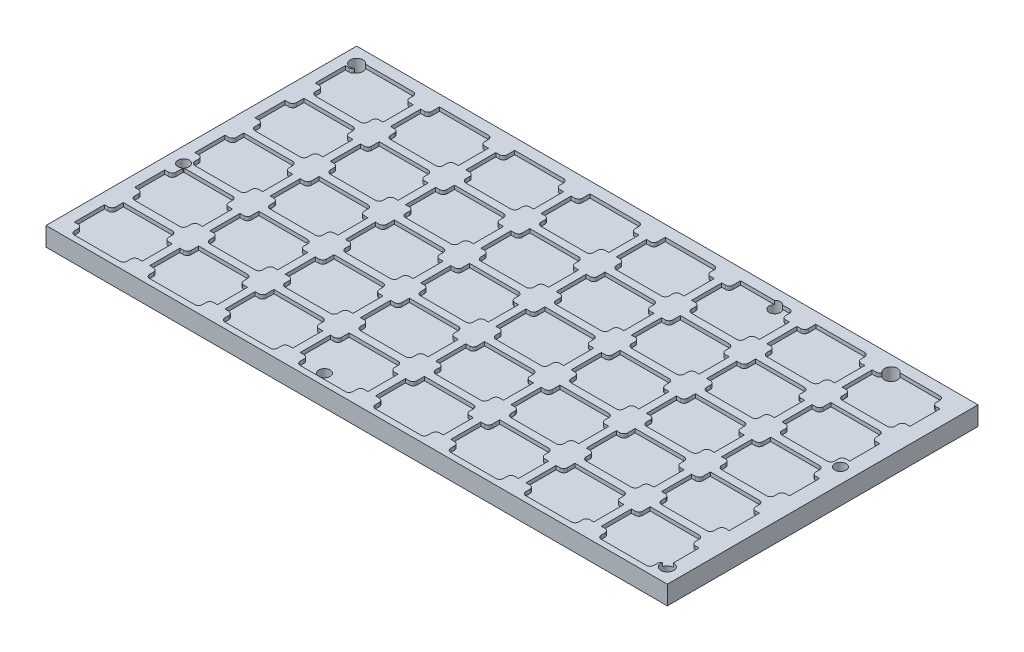
from build123d import *

# Parameters (mm, degrees)
SKETCH1_W                                       = 165.1
SKETCH1_H                                       = 82.55
BOSS_EXTRUDE1_DEPTH                             = 5
SKETCH2_W                                       = 14
SKETCH2_H                                       = 14
SKETCH2_W_2                                     = 2
SKETCH2_H_2                                     = 8
CUT_EXTRUDE1_DEPTH                              = 1
FILLET1_R                                       = 1
LPATTERN1_START                                 = 4
LPATTERN1_DEPTH                                 = 1
CSK_FOR_M3_FLAT_HEAD_MACHINE_SCREW1_D           = 3.4
CSK_FOR_M3_FLAT_HEAD_MACHINE_SCREW1_DEPTH       = 17.07
CSK_FOR_M3_FLAT_HEAD_MACHINE_SCREW1_CSINK_D     = 6.3
CSK_FOR_M3_FLAT_HEAD_MACHINE_SCREW1_CSINK_ANGLE = 90
CSK_FOR_M3_FLAT_HEAD_MACHINE_SCREW1_TIP         = 1.021463052
CSK_FOR_M3_FLAT_HEAD_MACHINE_SCREW2_D           = 3
CSK_FOR_M3_FLAT_HEAD_MACHINE_SCREW2_CSINK_D     = 6
CSK_FOR_M3_FLAT_HEAD_MACHINE_SCREW2_CSINK_ANGLE = 150


# Read off the part's stored shape, not the designer's step: LPattern1
with BuildPart() as part:
    # Sketch1 → Boss-Extrude1 (new body)
    with BuildSketch(Plane(origin=(0, 0, 0), x_dir=(1, 0, 0), z_dir=(0, 1, 0))):
        with Locations((81.157910906, -40.789208909)):
            Rectangle(SKETCH1_W, SKETCH1_H)
    extrude(amount=BOSS_EXTRUDE1_DEPTH)

    # Sketch2 → Cut-Extrude1 (cut)
    with BuildSketch(Plane(origin=(0, 5, 0), x_dir=(1, 0, 0), z_dir=(0, 1, 0))):
        with Locations((10.607910906, -9.514208909)):
            Rectangle(SKETCH2_W, SKETCH2_H)
        with Locations((18.607910906, -9.514208909)):
            Rectangle(SKETCH2_W_2, SKETCH2_H_2)
        with Locations((2.607910906, -9.514208909)):
            Rectangle(SKETCH2_W_2, SKETCH2_H_2)
    extrude(amount=-CUT_EXTRUDE1_DEPTH, mode=Mode.SUBTRACT)

    # Fillet1
    fillet1_edges = [part.edges().sort_by_distance(p)[0] for p in [
        (3.607910906, 4.5, 5.514208909),
        (3.607910906, 4.5, 13.514208909),
        (3.607910906, 4.5, 16.514208909),
        (17.607910906, 4.5, 16.514208909),
        (17.607910906, 4.5, 13.514208909),
        (17.607910906, 4.5, 5.514208909),
        (17.607910906, 4.5, 2.514208909),
    ]]
    fillet(fillet1_edges, radius=FILLET1_R)

    # LPattern1 outline → LPattern1 (cut)
    with BuildSketch(Plane(origin=(0, 0, 0), x_dir=(1, 0, 0), z_dir=(0, 1, 0)).offset(LPATTERN1_START)):
        with BuildLine():
            ThreePointArc((143.607910906, -68.514208909), (143.315017687, -69.221315691), (142.607910906, -69.514208909))
            Line((142.607910906, -69.514208909), (141.607910906, -69.514208909))
            Line((141.607910906, -69.514208909), (141.607910906, -77.514208909))
            Line((141.607910906, -77.514208909), (142.607910906, -77.514208909))
            ThreePointArc((142.607910906, -77.514208909), (143.315017687, -77.807102128), (143.607910906, -78.514208909))
            Line((143.607910906, -78.514208909), (143.607910906, -79.514208909))
            ThreePointArc((143.607910906, -79.514208909), (143.900804125, -80.221315691), (144.607910906, -80.514208909))
            Line((144.607910906, -80.514208909), (156.607910906, -80.514208909))
            ThreePointArc((156.607910906, -80.514208909), (157.315017687, -80.221315691), (157.607910906, -79.514208909))
            Line((157.607910906, -79.514208909), (157.607910906, -78.514208909))
            ThreePointArc((157.607910906, -78.514208909), (157.900804125, -77.807102128), (158.607910906, -77.514208909))
            Line((158.607910906, -77.514208909), (159.607910906, -77.514208909))
            Line((159.607910906, -77.514208909), (159.607910906, -69.514208909))
            Line((159.607910906, -69.514208909), (158.607910906, -69.514208909))
            ThreePointArc((158.607910906, -69.514208909), (157.900804125, -69.221315691), (157.607910906, -68.514208909))
            Line((157.607910906, -68.514208909), (157.607910906, -67.514208909))
            ThreePointArc((157.607910906, -67.514208909), (157.315017687, -66.807102128), (156.607910906, -66.514208909))
            Line((156.607910906, -66.514208909), (143.607910906, -66.514208909))
            Line((143.607910906, -66.514208909), (143.607910906, -68.514208909))
        make_face()
        with BuildLine():
            Line((157.607910906, -52.514208909), (157.607910906, -51.514208909))
            ThreePointArc((157.607910906, -51.514208909), (157.315017687, -50.807102128), (156.607910906, -50.514208909))
            Line((156.607910906, -50.514208909), (143.607910906, -50.514208909))
            Line((143.607910906, -50.514208909), (143.607910906, -52.514208909))
            ThreePointArc((143.607910906, -52.514208909), (143.315017687, -53.22131569), (142.607910906, -53.514208909))
            Line((142.607910906, -53.514208909), (141.607910906, -53.514208909))
            Line((141.607910906, -53.514208909), (141.607910906, -61.514208909))
            Line((141.607910906, -61.514208909), (142.607910906, -61.514208909))
            ThreePointArc((142.607910906, -61.514208909), (143.315017687, -61.807102128), (143.607910906, -62.514208909))
            Line((143.607910906, -62.514208909), (143.607910906, -63.514208909))
            ThreePointArc((143.607910906, -63.514208909), (143.900804125, -64.22131569), (144.607910906, -64.514208909))
            Line((144.607910906, -64.514208909), (156.607910906, -64.514208909))
            ThreePointArc((156.607910906, -64.514208909), (157.315017687, -64.22131569), (157.607910906, -63.514208909))
            Line((157.607910906, -63.514208909), (157.607910906, -62.514208909))
            ThreePointArc((157.607910906, -62.514208909), (157.900804125, -61.807102128), (158.607910906, -61.514208909))
            Line((158.607910906, -61.514208909), (159.607910906, -61.514208909))
            Line((159.607910906, -61.514208909), (159.607910906, -53.514208909))
            Line((159.607910906, -53.514208909), (158.607910906, -53.514208909))
            ThreePointArc((158.607910906, -53.514208909), (157.900804125, -53.22131569), (157.607910906, -52.514208909))
        make_face()
        with BuildLine():
            Line((157.607910906, -36.514208909), (157.607910906, -35.514208909))
            ThreePointArc((157.607910906, -35.514208909), (157.315017687, -34.807102128), (156.607910906, -34.514208909))
            Line((156.607910906, -34.514208909), (143.607910906, -34.514208909))
            Line((143.607910906, -34.514208909), (143.607910906, -36.514208909))
            ThreePointArc((143.607910906, -36.514208909), (143.315017687, -37.22131569), (142.607910906, -37.514208909))
            Line((142.607910906, -37.514208909), (141.607910906, -37.514208909))
            Line((141.607910906, -37.514208909), (141.607910906, -45.514208909))
            Line((141.607910906, -45.514208909), (142.607910906, -45.514208909))
            ThreePointArc((142.607910906, -45.514208909), (143.315017687, -45.807102128), (143.607910906, -46.514208909))
            Line((143.607910906, -46.514208909), (143.607910906, -47.514208909))
            ThreePointArc((143.607910906, -47.514208909), (143.900804125, -48.22131569), (144.607910906, -48.514208909))
            Line((144.607910906, -48.514208909), (156.607910906, -48.514208909))
            ThreePointArc((156.607910906, -48.514208909), (157.315017687, -48.22131569), (157.607910906, -47.514208909))
            Line((157.607910906, -47.514208909), (157.607910906, -46.514208909))
            ThreePointArc((157.607910906, -46.514208909), (157.900804125, -45.807102128), (158.607910906, -45.514208909))
            Line((158.607910906, -45.514208909), (159.607910906, -45.514208909))
            Line((159.607910906, -45.514208909), (159.607910906, -37.514208909))
            Line((159.607910906, -37.514208909), (158.607910906, -37.514208909))
            ThreePointArc((158.607910906, -37.514208909), (157.900804125, -37.22131569), (157.607910906, -36.514208909))
        make_face()
        with BuildLine():
            Line((157.607910906, -20.514208909), (157.607910906, -19.514208909))
            ThreePointArc((157.607910906, -19.514208909), (157.315017687, -18.807102128), (156.607910906, -18.514208909))
            Line((156.607910906, -18.514208909), (143.607910906, -18.514208909))
            Line((143.607910906, -18.514208909), (143.607910906, -20.514208909))
            ThreePointArc((143.607910906, -20.514208909), (143.315017687, -21.22131569), (142.607910906, -21.514208909))
            Line((142.607910906, -21.514208909), (141.607910906, -21.514208909))
            Line((141.607910906, -21.514208909), (141.607910906, -29.514208909))
            Line((141.607910906, -29.514208909), (142.607910906, -29.514208909))
            ThreePointArc((142.607910906, -29.514208909), (143.315017687, -29.807102128), (143.607910906, -30.514208909))
            Line((143.607910906, -30.514208909), (143.607910906, -31.514208909))
            ThreePointArc((143.607910906, -31.514208909), (143.900804125, -32.22131569), (144.607910906, -32.514208909))
            Line((144.607910906, -32.514208909), (156.607910906, -32.514208909))
            ThreePointArc((156.607910906, -32.514208909), (157.315017687, -32.22131569), (157.607910906, -31.514208909))
            Line((157.607910906, -31.514208909), (157.607910906, -30.514208909))
            ThreePointArc((157.607910906, -30.514208909), (157.900804125, -29.807102128), (158.607910906, -29.514208909))
            Line((158.607910906, -29.514208909), (159.607910906, -29.514208909))
            Line((159.607910906, -29.514208909), (159.607910906, -21.514208909))
            Line((159.607910906, -21.514208909), (158.607910906, -21.514208909))
            ThreePointArc((158.607910906, -21.514208909), (157.900804125, -21.22131569), (157.607910906, -20.514208909))
        make_face()
        with BuildLine():
            Line((157.607910906, -4.514208909), (157.607910906, -3.514208909))
            ThreePointArc((157.607910906, -3.514208909), (157.315017687, -2.807102128), (156.607910906, -2.514208909))
            Line((156.607910906, -2.514208909), (143.607910906, -2.514208909))
            Line((143.607910906, -2.514208909), (143.607910906, -4.514208909))
            ThreePointArc((143.607910906, -4.514208909), (143.315017687, -5.22131569), (142.607910906, -5.514208909))
            Line((142.607910906, -5.514208909), (141.607910906, -5.514208909))
            Line((141.607910906, -5.514208909), (141.607910906, -13.514208909))
            Line((141.607910906, -13.514208909), (142.607910906, -13.514208909))
            ThreePointArc((142.607910906, -13.514208909), (143.315017687, -13.807102128), (143.607910906, -14.514208909))
            Line((143.607910906, -14.514208909), (143.607910906, -15.514208909))
            ThreePointArc((143.607910906, -15.514208909), (143.900804125, -16.22131569), (144.607910906, -16.514208909))
            Line((144.607910906, -16.514208909), (156.607910906, -16.514208909))
            ThreePointArc((156.607910906, -16.514208909), (157.315017687, -16.22131569), (157.607910906, -15.514208909))
            Line((157.607910906, -15.514208909), (157.607910906, -14.514208909))
            ThreePointArc((157.607910906, -14.514208909), (157.900804125, -13.807102128), (158.607910906, -13.514208909))
            Line((158.607910906, -13.514208909), (159.607910906, -13.514208909))
            Line((159.607910906, -13.514208909), (159.607910906, -5.514208909))
            Line((159.607910906, -5.514208909), (158.607910906, -5.514208909))
            ThreePointArc((158.607910906, -5.514208909), (157.900804125, -5.22131569), (157.607910906, -4.514208909))
        make_face()
        with BuildLine():
            Line((136.607910906, -66.514208909), (123.607910906, -66.514208909))
            Line((123.607910906, -66.514208909), (123.607910906, -68.514208909))
            ThreePointArc((123.607910906, -68.514208909), (123.315017687, -69.221315691), (122.607910906, -69.514208909))
            Line((122.607910906, -69.514208909), (121.607910906, -69.514208909))
            Line((121.607910906, -69.514208909), (121.607910906, -77.514208909))
            Line((121.607910906, -77.514208909), (122.607910906, -77.514208909))
            ThreePointArc((122.607910906, -77.514208909), (123.315017687, -77.807102128), (123.607910906, -78.514208909))
            Line((123.607910906, -78.514208909), (123.607910906, -79.514208909))
            ThreePointArc((123.607910906, -79.514208909), (123.900804124, -80.221315691), (124.607910906, -80.514208909))
            Line((124.607910906, -80.514208909), (136.607910906, -80.514208909))
            ThreePointArc((136.607910906, -80.514208909), (137.315017687, -80.221315691), (137.607910906, -79.514208909))
            Line((137.607910906, -79.514208909), (137.607910906, -78.514208909))
            ThreePointArc((137.607910906, -78.514208909), (137.900804125, -77.807102128), (138.607910906, -77.514208909))
            Line((138.607910906, -77.514208909), (139.607910906, -77.514208909))
            Line((139.607910906, -77.514208909), (139.607910906, -69.514208909))
            Line((139.607910906, -69.514208909), (138.607910906, -69.514208909))
            ThreePointArc((138.607910906, -69.514208909), (137.900804125, -69.221315691), (137.607910906, -68.514208909))
            Line((137.607910906, -68.514208909), (137.607910906, -67.514208909))
            ThreePointArc((137.607910906, -67.514208909), (137.315017687, -66.807102128), (136.607910906, -66.514208909))
        make_face()
        with BuildLine():
            Line((116.607910906, -66.514208909), (103.607910906, -66.514208909))
            Line((103.607910906, -66.514208909), (103.607910906, -68.514208909))
            ThreePointArc((103.607910906, -68.514208909), (103.315017687, -69.221315691), (102.607910906, -69.514208909))
            Line((102.607910906, -69.514208909), (101.607910906, -69.514208909))
            Line((101.607910906, -69.514208909), (101.607910906, -77.514208909))
            Line((101.607910906, -77.514208909), (102.607910906, -77.514208909))
            ThreePointArc((102.607910906, -77.514208909), (103.315017687, -77.807102128), (103.607910906, -78.514208909))
            Line((103.607910906, -78.514208909), (103.607910906, -79.514208909))
            ThreePointArc((103.607910906, -79.514208909), (103.900804124, -80.221315691), (104.607910906, -80.514208909))
            Line((104.607910906, -80.514208909), (116.607910906, -80.514208909))
            ThreePointArc((116.607910906, -80.514208909), (117.315017687, -80.221315691), (117.607910906, -79.514208909))
            Line((117.607910906, -79.514208909), (117.607910906, -78.514208909))
            ThreePointArc((117.607910906, -78.514208909), (117.900804125, -77.807102128), (118.607910906, -77.514208909))
            Line((118.607910906, -77.514208909), (119.607910906, -77.514208909))
            Line((119.607910906, -77.514208909), (119.607910906, -69.514208909))
            Line((119.607910906, -69.514208909), (118.607910906, -69.514208909))
            ThreePointArc((118.607910906, -69.514208909), (117.900804124, -69.221315691), (117.607910906, -68.514208909))
            Line((117.607910906, -68.514208909), (117.607910906, -67.514208909))
            ThreePointArc((117.607910906, -67.514208909), (117.315017687, -66.807102128), (116.607910906, -66.514208909))
        make_face()
        with BuildLine():
            Line((96.607910906, -66.514208909), (83.607910906, -66.514208909))
            Line((83.607910906, -66.514208909), (83.607910906, -68.514208909))
            ThreePointArc((83.607910906, -68.514208909), (83.315017687, -69.221315691), (82.607910906, -69.514208909))
            Line((82.607910906, -69.514208909), (81.607910906, -69.514208909))
            Line((81.607910906, -69.514208909), (81.607910906, -77.514208909))
            Line((81.607910906, -77.514208909), (82.607910906, -77.514208909))
            ThreePointArc((82.607910906, -77.514208909), (83.315017687, -77.807102128), (83.607910906, -78.514208909))
            Line((83.607910906, -78.514208909), (83.607910906, -79.514208909))
            ThreePointArc((83.607910906, -79.514208909), (83.900804124, -80.221315691), (84.607910906, -80.514208909))
            Line((84.607910906, -80.514208909), (96.607910906, -80.514208909))
            ThreePointArc((96.607910906, -80.514208909), (97.315017687, -80.221315691), (97.607910906, -79.514208909))
            Line((97.607910906, -79.514208909), (97.607910906, -78.514208909))
            ThreePointArc((97.607910906, -78.514208909), (97.900804125, -77.807102128), (98.607910906, -77.514208909))
            Line((98.607910906, -77.514208909), (99.607910906, -77.514208909))
            Line((99.607910906, -77.514208909), (99.607910906, -69.514208909))
            Line((99.607910906, -69.514208909), (98.607910906, -69.514208909))
            ThreePointArc((98.607910906, -69.514208909), (97.900804124, -69.221315691), (97.607910906, -68.514208909))
            Line((97.607910906, -68.514208909), (97.607910906, -67.514208909))
            ThreePointArc((97.607910906, -67.514208909), (97.315017687, -66.807102128), (96.607910906, -66.514208909))
        make_face()
        with BuildLine():
            Line((76.607910906, -66.514208909), (63.607910906, -66.514208909))
            Line((63.607910906, -66.514208909), (63.607910906, -68.514208909))
            ThreePointArc((63.607910906, -68.514208909), (63.315017687, -69.221315691), (62.607910906, -69.514208909))
            Line((62.607910906, -69.514208909), (61.607910906, -69.514208909))
            Line((61.607910906, -69.514208909), (61.607910906, -77.514208909))
            Line((61.607910906, -77.514208909), (62.607910906, -77.514208909))
            ThreePointArc((62.607910906, -77.514208909), (63.315017687, -77.807102128), (63.607910906, -78.514208909))
            Line((63.607910906, -78.514208909), (63.607910906, -79.514208909))
            ThreePointArc((63.607910906, -79.514208909), (63.900804124, -80.221315691), (64.607910906, -80.514208909))
            Line((64.607910906, -80.514208909), (76.607910906, -80.514208909))
            ThreePointArc((76.607910906, -80.514208909), (77.315017687, -80.221315691), (77.607910906, -79.514208909))
            Line((77.607910906, -79.514208909), (77.607910906, -78.514208909))
            ThreePointArc((77.607910906, -78.514208909), (77.900804125, -77.807102128), (78.607910906, -77.514208909))
            Line((78.607910906, -77.514208909), (79.607910906, -77.514208909))
            Line((79.607910906, -77.514208909), (79.607910906, -69.514208909))
            Line((79.607910906, -69.514208909), (78.607910906, -69.514208909))
            ThreePointArc((78.607910906, -69.514208909), (77.900804124, -69.221315691), (77.607910906, -68.514208909))
            Line((77.607910906, -68.514208909), (77.607910906, -67.514208909))
            ThreePointArc((77.607910906, -67.514208909), (77.315017687, -66.807102128), (76.607910906, -66.514208909))
        make_face()
        with BuildLine():
            Line((56.607910906, -66.514208909), (43.607910906, -66.514208909))
            Line((43.607910906, -66.514208909), (43.607910906, -68.514208909))
            ThreePointArc((43.607910906, -68.514208909), (43.315017687, -69.221315691), (42.607910906, -69.514208909))
            Line((42.607910906, -69.514208909), (41.607910906, -69.514208909))
            Line((41.607910906, -69.514208909), (41.607910906, -77.514208909))
            Line((41.607910906, -77.514208909), (42.607910906, -77.514208909))
            ThreePointArc((42.607910906, -77.514208909), (43.315017687, -77.807102128), (43.607910906, -78.514208909))
            Line((43.607910906, -78.514208909), (43.607910906, -79.514208909))
            ThreePointArc((43.607910906, -79.514208909), (43.900804125, -80.221315691), (44.607910906, -80.514208909))
            Line((44.607910906, -80.514208909), (56.607910906, -80.514208909))
            ThreePointArc((56.607910906, -80.514208909), (57.315017687, -80.221315691), (57.607910906, -79.514208909))
            Line((57.607910906, -79.514208909), (57.607910906, -78.514208909))
            ThreePointArc((57.607910906, -78.514208909), (57.900804125, -77.807102128), (58.607910906, -77.514208909))
            Line((58.607910906, -77.514208909), (59.607910906, -77.514208909))
            Line((59.607910906, -77.514208909), (59.607910906, -69.514208909))
            Line((59.607910906, -69.514208909), (58.607910906, -69.514208909))
            ThreePointArc((58.607910906, -69.514208909), (57.900804125, -69.221315691), (57.607910906, -68.514208909))
            Line((57.607910906, -68.514208909), (57.607910906, -67.514208909))
            ThreePointArc((57.607910906, -67.514208909), (57.315017687, -66.807102128), (56.607910906, -66.514208909))
        make_face()
        with BuildLine():
            Line((36.607910906, -66.514208909), (23.607910906, -66.514208909))
            Line((23.607910906, -66.514208909), (23.607910906, -68.514208909))
            ThreePointArc((23.607910906, -68.514208909), (23.315017687, -69.221315691), (22.607910906, -69.514208909))
            Line((22.607910906, -69.514208909), (21.607910906, -69.514208909))
            Line((21.607910906, -69.514208909), (21.607910906, -77.514208909))
            Line((21.607910906, -77.514208909), (22.607910906, -77.514208909))
            ThreePointArc((22.607910906, -77.514208909), (23.315017687, -77.807102128), (23.607910906, -78.514208909))
            Line((23.607910906, -78.514208909), (23.607910906, -79.514208909))
            ThreePointArc((23.607910906, -79.514208909), (23.900804125, -80.221315691), (24.607910906, -80.514208909))
            Line((24.607910906, -80.514208909), (36.607910906, -80.514208909))
            ThreePointArc((36.607910906, -80.514208909), (37.315017687, -80.221315691), (37.607910906, -79.514208909))
            Line((37.607910906, -79.514208909), (37.607910906, -78.514208909))
            ThreePointArc((37.607910906, -78.514208909), (37.900804125, -77.807102128), (38.607910906, -77.514208909))
            Line((38.607910906, -77.514208909), (39.607910906, -77.514208909))
            Line((39.607910906, -77.514208909), (39.607910906, -69.514208909))
            Line((39.607910906, -69.514208909), (38.607910906, -69.514208909))
            ThreePointArc((38.607910906, -69.514208909), (37.900804125, -69.221315691), (37.607910906, -68.514208909))
            Line((37.607910906, -68.514208909), (37.607910906, -67.514208909))
            ThreePointArc((37.607910906, -67.514208909), (37.315017687, -66.807102128), (36.607910906, -66.514208909))
        make_face()
        with BuildLine():
            Line((16.607910906, -66.514208909), (3.607910906, -66.514208909))
            Line((3.607910906, -66.514208909), (3.607910906, -68.514208909))
            ThreePointArc((3.607910906, -68.514208909), (3.315017687, -69.221315691), (2.607910906, -69.514208909))
            Line((2.607910906, -69.514208909), (1.607910906, -69.514208909))
            Line((1.607910906, -69.514208909), (1.607910906, -77.514208909))
            Line((1.607910906, -77.514208909), (2.607910906, -77.514208909))
            ThreePointArc((2.607910906, -77.514208909), (3.315017687, -77.807102128), (3.607910906, -78.514208909))
            Line((3.607910906, -78.514208909), (3.607910906, -79.514208909))
            ThreePointArc((3.607910906, -79.514208909), (3.900804125, -80.221315691), (4.607910906, -80.514208909))
            Line((4.607910906, -80.514208909), (16.607910906, -80.514208909))
            ThreePointArc((16.607910906, -80.514208909), (17.315017687, -80.221315691), (17.607910906, -79.514208909))
            Line((17.607910906, -79.514208909), (17.607910906, -78.514208909))
            ThreePointArc((17.607910906, -78.514208909), (17.900804125, -77.807102128), (18.607910906, -77.514208909))
            Line((18.607910906, -77.514208909), (19.607910906, -77.514208909))
            Line((19.607910906, -77.514208909), (19.607910906, -69.514208909))
            Line((19.607910906, -69.514208909), (18.607910906, -69.514208909))
            ThreePointArc((18.607910906, -69.514208909), (17.900804125, -69.221315691), (17.607910906, -68.514208909))
            Line((17.607910906, -68.514208909), (17.607910906, -67.514208909))
            ThreePointArc((17.607910906, -67.514208909), (17.315017687, -66.807102128), (16.607910906, -66.514208909))
        make_face()
        with BuildLine():
            Line((137.607910906, -52.514208909), (137.607910906, -51.514208909))
            ThreePointArc((137.607910906, -51.514208909), (137.315017687, -50.807102128), (136.607910906, -50.514208909))
            Line((136.607910906, -50.514208909), (123.607910906, -50.514208909))
            Line((123.607910906, -50.514208909), (123.607910906, -52.514208909))
            ThreePointArc((123.607910906, -52.514208909), (123.315017688, -53.22131569), (122.607910906, -53.514208909))
            Line((122.607910906, -53.514208909), (121.607910906, -53.514208909))
            Line((121.607910906, -53.514208909), (121.607910906, -61.514208909))
            Line((121.607910906, -61.514208909), (122.607910906, -61.514208909))
            ThreePointArc((122.607910906, -61.514208909), (123.315017687, -61.807102128), (123.607910906, -62.514208909))
            Line((123.607910906, -62.514208909), (123.607910906, -63.514208909))
            ThreePointArc((123.607910906, -63.514208909), (123.900804124, -64.221315691), (124.607910906, -64.514208909))
            Line((124.607910906, -64.514208909), (136.607910906, -64.514208909))
            ThreePointArc((136.607910906, -64.514208909), (137.315017687, -64.22131569), (137.607910906, -63.514208909))
            Line((137.607910906, -63.514208909), (137.607910906, -62.514208909))
            ThreePointArc((137.607910906, -62.514208909), (137.900804125, -61.807102128), (138.607910906, -61.514208909))
            Line((138.607910906, -61.514208909), (139.607910906, -61.514208909))
            Line((139.607910906, -61.514208909), (139.607910906, -53.514208909))
            Line((139.607910906, -53.514208909), (138.607910906, -53.514208909))
            ThreePointArc((138.607910906, -53.514208909), (137.900804125, -53.22131569), (137.607910906, -52.514208909))
        make_face()
        with BuildLine():
            Line((137.607910906, -36.514208909), (137.607910906, -35.514208909))
            ThreePointArc((137.607910906, -35.514208909), (137.315017687, -34.807102128), (136.607910906, -34.514208909))
            Line((136.607910906, -34.514208909), (123.607910906, -34.514208909))
            Line((123.607910906, -34.514208909), (123.607910906, -36.514208909))
            ThreePointArc((123.607910906, -36.514208909), (123.315017688, -37.22131569), (122.607910906, -37.514208909))
            Line((122.607910906, -37.514208909), (121.607910906, -37.514208909))
            Line((121.607910906, -37.514208909), (121.607910906, -45.514208909))
            Line((121.607910906, -45.514208909), (122.607910906, -45.514208909))
            ThreePointArc((122.607910906, -45.514208909), (123.315017687, -45.807102128), (123.607910906, -46.514208909))
            Line((123.607910906, -46.514208909), (123.607910906, -47.514208909))
            ThreePointArc((123.607910906, -47.514208909), (123.900804124, -48.221315691), (124.607910906, -48.514208909))
            Line((124.607910906, -48.514208909), (136.607910906, -48.514208909))
            ThreePointArc((136.607910906, -48.514208909), (137.315017687, -48.22131569), (137.607910906, -47.514208909))
            Line((137.607910906, -47.514208909), (137.607910906, -46.514208909))
            ThreePointArc((137.607910906, -46.514208909), (137.900804125, -45.807102128), (138.607910906, -45.514208909))
            Line((138.607910906, -45.514208909), (139.607910906, -45.514208909))
            Line((139.607910906, -45.514208909), (139.607910906, -37.514208909))
            Line((139.607910906, -37.514208909), (138.607910906, -37.514208909))
            ThreePointArc((138.607910906, -37.514208909), (137.900804125, -37.22131569), (137.607910906, -36.514208909))
        make_face()
        with BuildLine():
            Line((137.607910906, -20.514208909), (137.607910906, -19.514208909))
            ThreePointArc((137.607910906, -19.514208909), (137.315017687, -18.807102128), (136.607910906, -18.514208909))
            Line((136.607910906, -18.514208909), (123.607910906, -18.514208909))
            Line((123.607910906, -18.514208909), (123.607910906, -20.514208909))
            ThreePointArc((123.607910906, -20.514208909), (123.315017688, -21.22131569), (122.607910906, -21.514208909))
            Line((122.607910906, -21.514208909), (121.607910906, -21.514208909))
            Line((121.607910906, -21.514208909), (121.607910906, -29.514208909))
            Line((121.607910906, -29.514208909), (122.607910906, -29.514208909))
            ThreePointArc((122.607910906, -29.514208909), (123.315017687, -29.807102128), (123.607910906, -30.514208909))
            Line((123.607910906, -30.514208909), (123.607910906, -31.514208909))
            ThreePointArc((123.607910906, -31.514208909), (123.900804124, -32.221315691), (124.607910906, -32.514208909))
            Line((124.607910906, -32.514208909), (136.607910906, -32.514208909))
            ThreePointArc((136.607910906, -32.514208909), (137.315017687, -32.22131569), (137.607910906, -31.514208909))
            Line((137.607910906, -31.514208909), (137.607910906, -30.514208909))
            ThreePointArc((137.607910906, -30.514208909), (137.900804125, -29.807102128), (138.607910906, -29.514208909))
            Line((138.607910906, -29.514208909), (139.607910906, -29.514208909))
            Line((139.607910906, -29.514208909), (139.607910906, -21.514208909))
            Line((139.607910906, -21.514208909), (138.607910906, -21.514208909))
            ThreePointArc((138.607910906, -21.514208909), (137.900804125, -21.22131569), (137.607910906, -20.514208909))
        make_face()
        with BuildLine():
            Line((137.607910906, -4.514208909), (137.607910906, -3.514208909))
            ThreePointArc((137.607910906, -3.514208909), (137.315017687, -2.807102128), (136.607910906, -2.514208909))
            Line((136.607910906, -2.514208909), (123.607910906, -2.514208909))
            Line((123.607910906, -2.514208909), (123.607910906, -4.514208909))
            ThreePointArc((123.607910906, -4.514208909), (123.315017688, -5.22131569), (122.607910906, -5.514208909))
            Line((122.607910906, -5.514208909), (121.607910906, -5.514208909))
            Line((121.607910906, -5.514208909), (121.607910906, -13.514208909))
            Line((121.607910906, -13.514208909), (122.607910906, -13.514208909))
            ThreePointArc((122.607910906, -13.514208909), (123.315017687, -13.807102128), (123.607910906, -14.514208909))
            Line((123.607910906, -14.514208909), (123.607910906, -15.514208909))
            ThreePointArc((123.607910906, -15.514208909), (123.900804124, -16.221315691), (124.607910906, -16.514208909))
            Line((124.607910906, -16.514208909), (136.607910906, -16.514208909))
            ThreePointArc((136.607910906, -16.514208909), (137.315017687, -16.22131569), (137.607910906, -15.514208909))
            Line((137.607910906, -15.514208909), (137.607910906, -14.514208909))
            ThreePointArc((137.607910906, -14.514208909), (137.900804125, -13.807102128), (138.607910906, -13.514208909))
            Line((138.607910906, -13.514208909), (139.607910906, -13.514208909))
            Line((139.607910906, -13.514208909), (139.607910906, -5.514208909))
            Line((139.607910906, -5.514208909), (138.607910906, -5.514208909))
            ThreePointArc((138.607910906, -5.514208909), (137.900804125, -5.22131569), (137.607910906, -4.514208909))
        make_face()
        with BuildLine():
            Line((117.607910906, -52.514208909), (117.607910906, -51.514208909))
            ThreePointArc((117.607910906, -51.514208909), (117.315017687, -50.807102128), (116.607910906, -50.514208909))
            Line((116.607910906, -50.514208909), (103.607910906, -50.514208909))
            Line((103.607910906, -50.514208909), (103.607910906, -52.514208909))
            ThreePointArc((103.607910906, -52.514208909), (103.315017688, -53.22131569), (102.607910906, -53.514208909))
            Line((102.607910906, -53.514208909), (101.607910906, -53.514208909))
            Line((101.607910906, -53.514208909), (101.607910906, -61.514208909))
            Line((101.607910906, -61.514208909), (102.607910906, -61.514208909))
            ThreePointArc((102.607910906, -61.514208909), (103.315017687, -61.807102128), (103.607910906, -62.514208909))
            Line((103.607910906, -62.514208909), (103.607910906, -63.514208909))
            ThreePointArc((103.607910906, -63.514208909), (103.900804124, -64.221315691), (104.607910906, -64.514208909))
            Line((104.607910906, -64.514208909), (116.607910906, -64.514208909))
            ThreePointArc((116.607910906, -64.514208909), (117.315017688, -64.22131569), (117.607910906, -63.514208909))
            Line((117.607910906, -63.514208909), (117.607910906, -62.514208909))
            ThreePointArc((117.607910906, -62.514208909), (117.900804125, -61.807102128), (118.607910906, -61.514208909))
            Line((118.607910906, -61.514208909), (119.607910906, -61.514208909))
            Line((119.607910906, -61.514208909), (119.607910906, -53.514208909))
            Line((119.607910906, -53.514208909), (118.607910906, -53.514208909))
            ThreePointArc((118.607910906, -53.514208909), (117.900804124, -53.221315691), (117.607910906, -52.514208909))
        make_face()
        with BuildLine():
            Line((117.607910906, -36.514208909), (117.607910906, -35.514208909))
            ThreePointArc((117.607910906, -35.514208909), (117.315017687, -34.807102128), (116.607910906, -34.514208909))
            Line((116.607910906, -34.514208909), (103.607910906, -34.514208909))
            Line((103.607910906, -34.514208909), (103.607910906, -36.514208909))
            ThreePointArc((103.607910906, -36.514208909), (103.315017688, -37.22131569), (102.607910906, -37.514208909))
            Line((102.607910906, -37.514208909), (101.607910906, -37.514208909))
            Line((101.607910906, -37.514208909), (101.607910906, -45.514208909))
            Line((101.607910906, -45.514208909), (102.607910906, -45.514208909))
            ThreePointArc((102.607910906, -45.514208909), (103.315017687, -45.807102128), (103.607910906, -46.514208909))
            Line((103.607910906, -46.514208909), (103.607910906, -47.514208909))
            ThreePointArc((103.607910906, -47.514208909), (103.900804124, -48.221315691), (104.607910906, -48.514208909))
            Line((104.607910906, -48.514208909), (116.607910906, -48.514208909))
            ThreePointArc((116.607910906, -48.514208909), (117.315017688, -48.22131569), (117.607910906, -47.514208909))
            Line((117.607910906, -47.514208909), (117.607910906, -46.514208909))
            ThreePointArc((117.607910906, -46.514208909), (117.900804125, -45.807102128), (118.607910906, -45.514208909))
            Line((118.607910906, -45.514208909), (119.607910906, -45.514208909))
            Line((119.607910906, -45.514208909), (119.607910906, -37.514208909))
            Line((119.607910906, -37.514208909), (118.607910906, -37.514208909))
            ThreePointArc((118.607910906, -37.514208909), (117.900804124, -37.221315691), (117.607910906, -36.514208909))
        make_face()
        with BuildLine():
            Line((117.607910906, -20.514208909), (117.607910906, -19.514208909))
            ThreePointArc((117.607910906, -19.514208909), (117.315017687, -18.807102128), (116.607910906, -18.514208909))
            Line((116.607910906, -18.514208909), (103.607910906, -18.514208909))
            Line((103.607910906, -18.514208909), (103.607910906, -20.514208909))
            ThreePointArc((103.607910906, -20.514208909), (103.315017688, -21.22131569), (102.607910906, -21.514208909))
            Line((102.607910906, -21.514208909), (101.607910906, -21.514208909))
            Line((101.607910906, -21.514208909), (101.607910906, -29.514208909))
            Line((101.607910906, -29.514208909), (102.607910906, -29.514208909))
            ThreePointArc((102.607910906, -29.514208909), (103.315017687, -29.807102128), (103.607910906, -30.514208909))
            Line((103.607910906, -30.514208909), (103.607910906, -31.514208909))
            ThreePointArc((103.607910906, -31.514208909), (103.900804124, -32.221315691), (104.607910906, -32.514208909))
            Line((104.607910906, -32.514208909), (116.607910906, -32.514208909))
            ThreePointArc((116.607910906, -32.514208909), (117.315017688, -32.22131569), (117.607910906, -31.514208909))
            Line((117.607910906, -31.514208909), (117.607910906, -30.514208909))
            ThreePointArc((117.607910906, -30.514208909), (117.900804125, -29.807102128), (118.607910906, -29.514208909))
            Line((118.607910906, -29.514208909), (119.607910906, -29.514208909))
            Line((119.607910906, -29.514208909), (119.607910906, -21.514208909))
            Line((119.607910906, -21.514208909), (118.607910906, -21.514208909))
            ThreePointArc((118.607910906, -21.514208909), (117.900804124, -21.221315691), (117.607910906, -20.514208909))
        make_face()
        with BuildLine():
            Line((117.607910906, -4.514208909), (117.607910906, -3.514208909))
            ThreePointArc((117.607910906, -3.514208909), (117.315017687, -2.807102128), (116.607910906, -2.514208909))
            Line((116.607910906, -2.514208909), (103.607910906, -2.514208909))
            Line((103.607910906, -2.514208909), (103.607910906, -4.514208909))
            ThreePointArc((103.607910906, -4.514208909), (103.315017688, -5.22131569), (102.607910906, -5.514208909))
            Line((102.607910906, -5.514208909), (101.607910906, -5.514208909))
            Line((101.607910906, -5.514208909), (101.607910906, -13.514208909))
            Line((101.607910906, -13.514208909), (102.607910906, -13.514208909))
            ThreePointArc((102.607910906, -13.514208909), (103.315017687, -13.807102128), (103.607910906, -14.514208909))
            Line((103.607910906, -14.514208909), (103.607910906, -15.514208909))
            ThreePointArc((103.607910906, -15.514208909), (103.900804124, -16.221315691), (104.607910906, -16.514208909))
            Line((104.607910906, -16.514208909), (116.607910906, -16.514208909))
            ThreePointArc((116.607910906, -16.514208909), (117.315017688, -16.22131569), (117.607910906, -15.514208909))
            Line((117.607910906, -15.514208909), (117.607910906, -14.514208909))
            ThreePointArc((117.607910906, -14.514208909), (117.900804125, -13.807102128), (118.607910906, -13.514208909))
            Line((118.607910906, -13.514208909), (119.607910906, -13.514208909))
            Line((119.607910906, -13.514208909), (119.607910906, -5.514208909))
            Line((119.607910906, -5.514208909), (118.607910906, -5.514208909))
            ThreePointArc((118.607910906, -5.514208909), (117.900804124, -5.221315691), (117.607910906, -4.514208909))
        make_face()
        with BuildLine():
            Line((97.607910906, -52.514208909), (97.607910906, -51.514208909))
            ThreePointArc((97.607910906, -51.514208909), (97.315017687, -50.807102128), (96.607910906, -50.514208909))
            Line((96.607910906, -50.514208909), (83.607910906, -50.514208909))
            Line((83.607910906, -50.514208909), (83.607910906, -52.514208909))
            ThreePointArc((83.607910906, -52.514208909), (83.315017688, -53.22131569), (82.607910906, -53.514208909))
            Line((82.607910906, -53.514208909), (81.607910906, -53.514208909))
            Line((81.607910906, -53.514208909), (81.607910906, -61.514208909))
            Line((81.607910906, -61.514208909), (82.607910906, -61.514208909))
            ThreePointArc((82.607910906, -61.514208909), (83.315017687, -61.807102128), (83.607910906, -62.514208909))
            Line((83.607910906, -62.514208909), (83.607910906, -63.514208909))
            ThreePointArc((83.607910906, -63.514208909), (83.900804124, -64.221315691), (84.607910906, -64.514208909))
            Line((84.607910906, -64.514208909), (96.607910906, -64.514208909))
            ThreePointArc((96.607910906, -64.514208909), (97.315017688, -64.22131569), (97.607910906, -63.514208909))
            Line((97.607910906, -63.514208909), (97.607910906, -62.514208909))
            ThreePointArc((97.607910906, -62.514208909), (97.900804125, -61.807102128), (98.607910906, -61.514208909))
            Line((98.607910906, -61.514208909), (99.607910906, -61.514208909))
            Line((99.607910906, -61.514208909), (99.607910906, -53.514208909))
            Line((99.607910906, -53.514208909), (98.607910906, -53.514208909))
            ThreePointArc((98.607910906, -53.514208909), (97.900804124, -53.221315691), (97.607910906, -52.514208909))
        make_face()
        with BuildLine():
            Line((97.607910906, -36.514208909), (97.607910906, -35.514208909))
            ThreePointArc((97.607910906, -35.514208909), (97.315017687, -34.807102128), (96.607910906, -34.514208909))
            Line((96.607910906, -34.514208909), (83.607910906, -34.514208909))
            Line((83.607910906, -34.514208909), (83.607910906, -36.514208909))
            ThreePointArc((83.607910906, -36.514208909), (83.315017688, -37.22131569), (82.607910906, -37.514208909))
            Line((82.607910906, -37.514208909), (81.607910906, -37.514208909))
            Line((81.607910906, -37.514208909), (81.607910906, -45.514208909))
            Line((81.607910906, -45.514208909), (82.607910906, -45.514208909))
            ThreePointArc((82.607910906, -45.514208909), (83.315017687, -45.807102128), (83.607910906, -46.514208909))
            Line((83.607910906, -46.514208909), (83.607910906, -47.514208909))
            ThreePointArc((83.607910906, -47.514208909), (83.900804124, -48.221315691), (84.607910906, -48.514208909))
            Line((84.607910906, -48.514208909), (96.607910906, -48.514208909))
            ThreePointArc((96.607910906, -48.514208909), (97.315017688, -48.22131569), (97.607910906, -47.514208909))
            Line((97.607910906, -47.514208909), (97.607910906, -46.514208909))
            ThreePointArc((97.607910906, -46.514208909), (97.900804125, -45.807102128), (98.607910906, -45.514208909))
            Line((98.607910906, -45.514208909), (99.607910906, -45.514208909))
            Line((99.607910906, -45.514208909), (99.607910906, -37.514208909))
            Line((99.607910906, -37.514208909), (98.607910906, -37.514208909))
            ThreePointArc((98.607910906, -37.514208909), (97.900804124, -37.221315691), (97.607910906, -36.514208909))
        make_face()
        with BuildLine():
            Line((97.607910906, -20.514208909), (97.607910906, -19.514208909))
            ThreePointArc((97.607910906, -19.514208909), (97.315017687, -18.807102128), (96.607910906, -18.514208909))
            Line((96.607910906, -18.514208909), (83.607910906, -18.514208909))
            Line((83.607910906, -18.514208909), (83.607910906, -20.514208909))
            ThreePointArc((83.607910906, -20.514208909), (83.315017688, -21.22131569), (82.607910906, -21.514208909))
            Line((82.607910906, -21.514208909), (81.607910906, -21.514208909))
            Line((81.607910906, -21.514208909), (81.607910906, -29.514208909))
            Line((81.607910906, -29.514208909), (82.607910906, -29.514208909))
            ThreePointArc((82.607910906, -29.514208909), (83.315017687, -29.807102128), (83.607910906, -30.514208909))
            Line((83.607910906, -30.514208909), (83.607910906, -31.514208909))
            ThreePointArc((83.607910906, -31.514208909), (83.900804124, -32.221315691), (84.607910906, -32.514208909))
            Line((84.607910906, -32.514208909), (96.607910906, -32.514208909))
            ThreePointArc((96.607910906, -32.514208909), (97.315017688, -32.22131569), (97.607910906, -31.514208909))
            Line((97.607910906, -31.514208909), (97.607910906, -30.514208909))
            ThreePointArc((97.607910906, -30.514208909), (97.900804125, -29.807102128), (98.607910906, -29.514208909))
            Line((98.607910906, -29.514208909), (99.607910906, -29.514208909))
            Line((99.607910906, -29.514208909), (99.607910906, -21.514208909))
            Line((99.607910906, -21.514208909), (98.607910906, -21.514208909))
            ThreePointArc((98.607910906, -21.514208909), (97.900804124, -21.221315691), (97.607910906, -20.514208909))
        make_face()
        with BuildLine():
            Line((97.607910906, -4.514208909), (97.607910906, -3.514208909))
            ThreePointArc((97.607910906, -3.514208909), (97.315017687, -2.807102128), (96.607910906, -2.514208909))
            Line((96.607910906, -2.514208909), (83.607910906, -2.514208909))
            Line((83.607910906, -2.514208909), (83.607910906, -4.514208909))
            ThreePointArc((83.607910906, -4.514208909), (83.315017688, -5.22131569), (82.607910906, -5.514208909))
            Line((82.607910906, -5.514208909), (81.607910906, -5.514208909))
            Line((81.607910906, -5.514208909), (81.607910906, -13.514208909))
            Line((81.607910906, -13.514208909), (82.607910906, -13.514208909))
            ThreePointArc((82.607910906, -13.514208909), (83.315017687, -13.807102128), (83.607910906, -14.514208909))
            Line((83.607910906, -14.514208909), (83.607910906, -15.514208909))
            ThreePointArc((83.607910906, -15.514208909), (83.900804124, -16.221315691), (84.607910906, -16.514208909))
            Line((84.607910906, -16.514208909), (96.607910906, -16.514208909))
            ThreePointArc((96.607910906, -16.514208909), (97.315017688, -16.22131569), (97.607910906, -15.514208909))
            Line((97.607910906, -15.514208909), (97.607910906, -14.514208909))
            ThreePointArc((97.607910906, -14.514208909), (97.900804125, -13.807102128), (98.607910906, -13.514208909))
            Line((98.607910906, -13.514208909), (99.607910906, -13.514208909))
            Line((99.607910906, -13.514208909), (99.607910906, -5.514208909))
            Line((99.607910906, -5.514208909), (98.607910906, -5.514208909))
            ThreePointArc((98.607910906, -5.514208909), (97.900804124, -5.221315691), (97.607910906, -4.514208909))
        make_face()
        with BuildLine():
            Line((77.607910906, -52.514208909), (77.607910906, -51.514208909))
            ThreePointArc((77.607910906, -51.514208909), (77.315017687, -50.807102128), (76.607910906, -50.514208909))
            Line((76.607910906, -50.514208909), (63.607910906, -50.514208909))
            Line((63.607910906, -50.514208909), (63.607910906, -52.514208909))
            ThreePointArc((63.607910906, -52.514208909), (63.315017688, -53.22131569), (62.607910906, -53.514208909))
            Line((62.607910906, -53.514208909), (61.607910906, -53.514208909))
            Line((61.607910906, -53.514208909), (61.607910906, -61.514208909))
            Line((61.607910906, -61.514208909), (62.607910906, -61.514208909))
            ThreePointArc((62.607910906, -61.514208909), (63.315017687, -61.807102128), (63.607910906, -62.514208909))
            Line((63.607910906, -62.514208909), (63.607910906, -63.514208909))
            ThreePointArc((63.607910906, -63.514208909), (63.900804125, -64.221315691), (64.607910906, -64.514208909))
            Line((64.607910906, -64.514208909), (76.607910906, -64.514208909))
            ThreePointArc((76.607910906, -64.514208909), (77.315017688, -64.22131569), (77.607910906, -63.514208909))
            Line((77.607910906, -63.514208909), (77.607910906, -62.514208909))
            ThreePointArc((77.607910906, -62.514208909), (77.900804125, -61.807102128), (78.607910906, -61.514208909))
            Line((78.607910906, -61.514208909), (79.607910906, -61.514208909))
            Line((79.607910906, -61.514208909), (79.607910906, -53.514208909))
            Line((79.607910906, -53.514208909), (78.607910906, -53.514208909))
            ThreePointArc((78.607910906, -53.514208909), (77.900804124, -53.221315691), (77.607910906, -52.514208909))
        make_face()
        with BuildLine():
            Line((77.607910906, -36.514208909), (77.607910906, -35.514208909))
            ThreePointArc((77.607910906, -35.514208909), (77.315017687, -34.807102128), (76.607910906, -34.514208909))
            Line((76.607910906, -34.514208909), (63.607910906, -34.514208909))
            Line((63.607910906, -34.514208909), (63.607910906, -36.514208909))
            ThreePointArc((63.607910906, -36.514208909), (63.315017688, -37.22131569), (62.607910906, -37.514208909))
            Line((62.607910906, -37.514208909), (61.607910906, -37.514208909))
            Line((61.607910906, -37.514208909), (61.607910906, -45.514208909))
            Line((61.607910906, -45.514208909), (62.607910906, -45.514208909))
            ThreePointArc((62.607910906, -45.514208909), (63.315017687, -45.807102128), (63.607910906, -46.514208909))
            Line((63.607910906, -46.514208909), (63.607910906, -47.514208909))
            ThreePointArc((63.607910906, -47.514208909), (63.900804124, -48.22131569), (64.607910906, -48.514208909))
            Line((64.607910906, -48.514208909), (76.607910906, -48.514208909))
            ThreePointArc((76.607910906, -48.514208909), (77.315017688, -48.22131569), (77.607910906, -47.514208909))
            Line((77.607910906, -47.514208909), (77.607910906, -46.514208909))
            ThreePointArc((77.607910906, -46.514208909), (77.900804125, -45.807102128), (78.607910906, -45.514208909))
            Line((78.607910906, -45.514208909), (79.607910906, -45.514208909))
            Line((79.607910906, -45.514208909), (79.607910906, -37.514208909))
            Line((79.607910906, -37.514208909), (78.607910906, -37.514208909))
            ThreePointArc((78.607910906, -37.514208909), (77.900804124, -37.221315691), (77.607910906, -36.514208909))
        make_face()
        with BuildLine():
            Line((77.607910906, -20.514208909), (77.607910906, -19.514208909))
            ThreePointArc((77.607910906, -19.514208909), (77.315017687, -18.807102128), (76.607910906, -18.514208909))
            Line((76.607910906, -18.514208909), (63.607910906, -18.514208909))
            Line((63.607910906, -18.514208909), (63.607910906, -20.514208909))
            ThreePointArc((63.607910906, -20.514208909), (63.315017688, -21.221315691), (62.607910906, -21.514208909))
            Line((62.607910906, -21.514208909), (61.607910906, -21.514208909))
            Line((61.607910906, -21.514208909), (61.607910906, -29.514208909))
            Line((61.607910906, -29.514208909), (62.607910906, -29.514208909))
            ThreePointArc((62.607910906, -29.514208909), (63.315017687, -29.807102128), (63.607910906, -30.514208909))
            Line((63.607910906, -30.514208909), (63.607910906, -31.514208909))
            ThreePointArc((63.607910906, -31.514208909), (63.900804124, -32.22131569), (64.607910906, -32.514208909))
            Line((64.607910906, -32.514208909), (76.607910906, -32.514208909))
            ThreePointArc((76.607910906, -32.514208909), (77.315017688, -32.22131569), (77.607910906, -31.514208909))
            Line((77.607910906, -31.514208909), (77.607910906, -30.514208909))
            ThreePointArc((77.607910906, -30.514208909), (77.900804125, -29.807102128), (78.607910906, -29.514208909))
            Line((78.607910906, -29.514208909), (79.607910906, -29.514208909))
            Line((79.607910906, -29.514208909), (79.607910906, -21.514208909))
            Line((79.607910906, -21.514208909), (78.607910906, -21.514208909))
            ThreePointArc((78.607910906, -21.514208909), (77.900804124, -21.221315691), (77.607910906, -20.514208909))
        make_face()
        with BuildLine():
            Line((77.607910906, -4.514208909), (77.607910906, -3.514208909))
            ThreePointArc((77.607910906, -3.514208909), (77.315017687, -2.807102128), (76.607910906, -2.514208909))
            Line((76.607910906, -2.514208909), (63.607910906, -2.514208909))
            Line((63.607910906, -2.514208909), (63.607910906, -4.514208909))
            ThreePointArc((63.607910906, -4.514208909), (63.315017688, -5.22131569), (62.607910906, -5.514208909))
            Line((62.607910906, -5.514208909), (61.607910906, -5.514208909))
            Line((61.607910906, -5.514208909), (61.607910906, -13.514208909))
            Line((61.607910906, -13.514208909), (62.607910906, -13.514208909))
            ThreePointArc((62.607910906, -13.514208909), (63.315017687, -13.807102128), (63.607910906, -14.514208909))
            Line((63.607910906, -14.514208909), (63.607910906, -15.514208909))
            ThreePointArc((63.607910906, -15.514208909), (63.900804124, -16.221315691), (64.607910906, -16.514208909))
            Line((64.607910906, -16.514208909), (76.607910906, -16.514208909))
            ThreePointArc((76.607910906, -16.514208909), (77.315017688, -16.22131569), (77.607910906, -15.514208909))
            Line((77.607910906, -15.514208909), (77.607910906, -14.514208909))
            ThreePointArc((77.607910906, -14.514208909), (77.900804125, -13.807102128), (78.607910906, -13.514208909))
            Line((78.607910906, -13.514208909), (79.607910906, -13.514208909))
            Line((79.607910906, -13.514208909), (79.607910906, -5.514208909))
            Line((79.607910906, -5.514208909), (78.607910906, -5.514208909))
            ThreePointArc((78.607910906, -5.514208909), (77.900804124, -5.221315691), (77.607910906, -4.514208909))
        make_face()
        with BuildLine():
            Line((57.607910906, -52.514208909), (57.607910906, -51.514208909))
            ThreePointArc((57.607910906, -51.514208909), (57.315017687, -50.807102128), (56.607910906, -50.514208909))
            Line((56.607910906, -50.514208909), (43.607910906, -50.514208909))
            Line((43.607910906, -50.514208909), (43.607910906, -52.514208909))
            ThreePointArc((43.607910906, -52.514208909), (43.315017688, -53.22131569), (42.607910906, -53.514208909))
            Line((42.607910906, -53.514208909), (41.607910906, -53.514208909))
            Line((41.607910906, -53.514208909), (41.607910906, -61.514208909))
            Line((41.607910906, -61.514208909), (42.607910906, -61.514208909))
            ThreePointArc((42.607910906, -61.514208909), (43.315017687, -61.807102128), (43.607910906, -62.514208909))
            Line((43.607910906, -62.514208909), (43.607910906, -63.514208909))
            ThreePointArc((43.607910906, -63.514208909), (43.900804125, -64.221315691), (44.607910906, -64.514208909))
            Line((44.607910906, -64.514208909), (56.607910906, -64.514208909))
            ThreePointArc((56.607910906, -64.514208909), (57.315017687, -64.221315691), (57.607910906, -63.514208909))
            Line((57.607910906, -63.514208909), (57.607910906, -62.514208909))
            ThreePointArc((57.607910906, -62.514208909), (57.900804125, -61.807102128), (58.607910906, -61.514208909))
            Line((58.607910906, -61.514208909), (59.607910906, -61.514208909))
            Line((59.607910906, -61.514208909), (59.607910906, -53.514208909))
            Line((59.607910906, -53.514208909), (58.607910906, -53.514208909))
            ThreePointArc((58.607910906, -53.514208909), (57.900804124, -53.22131569), (57.607910906, -52.514208909))
        make_face()
        with BuildLine():
            Line((57.607910906, -36.514208909), (57.607910906, -35.514208909))
            ThreePointArc((57.607910906, -35.514208909), (57.315017687, -34.807102128), (56.607910906, -34.514208909))
            Line((56.607910906, -34.514208909), (43.607910906, -34.514208909))
            Line((43.607910906, -34.514208909), (43.607910906, -36.514208909))
            ThreePointArc((43.607910906, -36.514208909), (43.315017688, -37.22131569), (42.607910906, -37.514208909))
            Line((42.607910906, -37.514208909), (41.607910906, -37.514208909))
            Line((41.607910906, -37.514208909), (41.607910906, -45.514208909))
            Line((41.607910906, -45.514208909), (42.607910906, -45.514208909))
            ThreePointArc((42.607910906, -45.514208909), (43.315017687, -45.807102128), (43.607910906, -46.514208909))
            Line((43.607910906, -46.514208909), (43.607910906, -47.514208909))
            ThreePointArc((43.607910906, -47.514208909), (43.900804124, -48.22131569), (44.607910906, -48.514208909))
            Line((44.607910906, -48.514208909), (56.607910906, -48.514208909))
            ThreePointArc((56.607910906, -48.514208909), (57.315017688, -48.22131569), (57.607910906, -47.514208909))
            Line((57.607910906, -47.514208909), (57.607910906, -46.514208909))
            ThreePointArc((57.607910906, -46.514208909), (57.900804125, -45.807102128), (58.607910906, -45.514208909))
            Line((58.607910906, -45.514208909), (59.607910906, -45.514208909))
            Line((59.607910906, -45.514208909), (59.607910906, -37.514208909))
            Line((59.607910906, -37.514208909), (58.607910906, -37.514208909))
            ThreePointArc((58.607910906, -37.514208909), (57.900804124, -37.22131569), (57.607910906, -36.514208909))
        make_face()
        with BuildLine():
            Line((57.607910906, -20.514208909), (57.607910906, -19.514208909))
            ThreePointArc((57.607910906, -19.514208909), (57.315017687, -18.807102128), (56.607910906, -18.514208909))
            Line((56.607910906, -18.514208909), (43.607910906, -18.514208909))
            Line((43.607910906, -18.514208909), (43.607910906, -20.514208909))
            ThreePointArc((43.607910906, -20.514208909), (43.315017688, -21.221315691), (42.607910906, -21.514208909))
            Line((42.607910906, -21.514208909), (41.607910906, -21.514208909))
            Line((41.607910906, -21.514208909), (41.607910906, -29.514208909))
            Line((41.607910906, -29.514208909), (42.607910906, -29.514208909))
            ThreePointArc((42.607910906, -29.514208909), (43.315017687, -29.807102128), (43.607910906, -30.514208909))
            Line((43.607910906, -30.514208909), (43.607910906, -31.514208909))
            ThreePointArc((43.607910906, -31.514208909), (43.900804124, -32.22131569), (44.607910906, -32.514208909))
            Line((44.607910906, -32.514208909), (56.607910906, -32.514208909))
            ThreePointArc((56.607910906, -32.514208909), (57.315017688, -32.22131569), (57.607910906, -31.514208909))
            Line((57.607910906, -31.514208909), (57.607910906, -30.514208909))
            ThreePointArc((57.607910906, -30.514208909), (57.900804125, -29.807102128), (58.607910906, -29.514208909))
            Line((58.607910906, -29.514208909), (59.607910906, -29.514208909))
            Line((59.607910906, -29.514208909), (59.607910906, -21.514208909))
            Line((59.607910906, -21.514208909), (58.607910906, -21.514208909))
            ThreePointArc((58.607910906, -21.514208909), (57.900804124, -21.221315691), (57.607910906, -20.514208909))
        make_face()
        with BuildLine():
            Line((57.607910906, -4.514208909), (57.607910906, -3.514208909))
            ThreePointArc((57.607910906, -3.514208909), (57.315017687, -2.807102128), (56.607910906, -2.514208909))
            Line((56.607910906, -2.514208909), (43.607910906, -2.514208909))
            Line((43.607910906, -2.514208909), (43.607910906, -4.514208909))
            ThreePointArc((43.607910906, -4.514208909), (43.315017688, -5.22131569), (42.607910906, -5.514208909))
            Line((42.607910906, -5.514208909), (41.607910906, -5.514208909))
            Line((41.607910906, -5.514208909), (41.607910906, -13.514208909))
            Line((41.607910906, -13.514208909), (42.607910906, -13.514208909))
            ThreePointArc((42.607910906, -13.514208909), (43.315017687, -13.807102128), (43.607910906, -14.514208909))
            Line((43.607910906, -14.514208909), (43.607910906, -15.514208909))
            ThreePointArc((43.607910906, -15.514208909), (43.900804124, -16.221315691), (44.607910906, -16.514208909))
            Line((44.607910906, -16.514208909), (56.607910906, -16.514208909))
            ThreePointArc((56.607910906, -16.514208909), (57.315017688, -16.221315691), (57.607910906, -15.514208909))
            Line((57.607910906, -15.514208909), (57.607910906, -14.514208909))
            ThreePointArc((57.607910906, -14.514208909), (57.900804125, -13.807102128), (58.607910906, -13.514208909))
            Line((58.607910906, -13.514208909), (59.607910906, -13.514208909))
            Line((59.607910906, -13.514208909), (59.607910906, -5.514208909))
            Line((59.607910906, -5.514208909), (58.607910906, -5.514208909))
            ThreePointArc((58.607910906, -5.514208909), (57.900804124, -5.22131569), (57.607910906, -4.514208909))
        make_face()
        with BuildLine():
            Line((37.607910906, -52.514208909), (37.607910906, -51.514208909))
            ThreePointArc((37.607910906, -51.514208909), (37.315017687, -50.807102128), (36.607910906, -50.514208909))
            Line((36.607910906, -50.514208909), (23.607910906, -50.514208909))
            Line((23.607910906, -50.514208909), (23.607910906, -52.514208909))
            ThreePointArc((23.607910906, -52.514208909), (23.315017688, -53.22131569), (22.607910906, -53.514208909))
            Line((22.607910906, -53.514208909), (21.607910906, -53.514208909))
            Line((21.607910906, -53.514208909), (21.607910906, -61.514208909))
            Line((21.607910906, -61.514208909), (22.607910906, -61.514208909))
            ThreePointArc((22.607910906, -61.514208909), (23.315017687, -61.807102128), (23.607910906, -62.514208909))
            Line((23.607910906, -62.514208909), (23.607910906, -63.514208909))
            ThreePointArc((23.607910906, -63.514208909), (23.900804125, -64.221315691), (24.607910906, -64.514208909))
            Line((24.607910906, -64.514208909), (36.607910906, -64.514208909))
            ThreePointArc((36.607910906, -64.514208909), (37.315017687, -64.221315691), (37.607910906, -63.514208909))
            Line((37.607910906, -63.514208909), (37.607910906, -62.514208909))
            ThreePointArc((37.607910906, -62.514208909), (37.900804125, -61.807102128), (38.607910906, -61.514208909))
            Line((38.607910906, -61.514208909), (39.607910906, -61.514208909))
            Line((39.607910906, -61.514208909), (39.607910906, -53.514208909))
            Line((39.607910906, -53.514208909), (38.607910906, -53.514208909))
            ThreePointArc((38.607910906, -53.514208909), (37.900804124, -53.22131569), (37.607910906, -52.514208909))
        make_face()
        with BuildLine():
            Line((37.607910906, -36.514208909), (37.607910906, -35.514208909))
            ThreePointArc((37.607910906, -35.514208909), (37.315017687, -34.807102128), (36.607910906, -34.514208909))
            Line((36.607910906, -34.514208909), (23.607910906, -34.514208909))
            Line((23.607910906, -34.514208909), (23.607910906, -36.514208909))
            ThreePointArc((23.607910906, -36.514208909), (23.315017688, -37.22131569), (22.607910906, -37.514208909))
            Line((22.607910906, -37.514208909), (21.607910906, -37.514208909))
            Line((21.607910906, -37.514208909), (21.607910906, -45.514208909))
            Line((21.607910906, -45.514208909), (22.607910906, -45.514208909))
            ThreePointArc((22.607910906, -45.514208909), (23.315017687, -45.807102128), (23.607910906, -46.514208909))
            Line((23.607910906, -46.514208909), (23.607910906, -47.514208909))
            ThreePointArc((23.607910906, -47.514208909), (23.900804124, -48.22131569), (24.607910906, -48.514208909))
            Line((24.607910906, -48.514208909), (36.607910906, -48.514208909))
            ThreePointArc((36.607910906, -48.514208909), (37.315017688, -48.22131569), (37.607910906, -47.514208909))
            Line((37.607910906, -47.514208909), (37.607910906, -46.514208909))
            ThreePointArc((37.607910906, -46.514208909), (37.900804125, -45.807102128), (38.607910906, -45.514208909))
            Line((38.607910906, -45.514208909), (39.607910906, -45.514208909))
            Line((39.607910906, -45.514208909), (39.607910906, -37.514208909))
            Line((39.607910906, -37.514208909), (38.607910906, -37.514208909))
            ThreePointArc((38.607910906, -37.514208909), (37.900804124, -37.22131569), (37.607910906, -36.514208909))
        make_face()
        with BuildLine():
            Line((37.607910906, -20.514208909), (37.607910906, -19.514208909))
            ThreePointArc((37.607910906, -19.514208909), (37.315017687, -18.807102128), (36.607910906, -18.514208909))
            Line((36.607910906, -18.514208909), (23.607910906, -18.514208909))
            Line((23.607910906, -18.514208909), (23.607910906, -20.514208909))
            ThreePointArc((23.607910906, -20.514208909), (23.315017687, -21.22131569), (22.607910906, -21.514208909))
            Line((22.607910906, -21.514208909), (21.607910906, -21.514208909))
            Line((21.607910906, -21.514208909), (21.607910906, -29.514208909))
            Line((21.607910906, -29.514208909), (22.607910906, -29.514208909))
            ThreePointArc((22.607910906, -29.514208909), (23.315017687, -29.807102128), (23.607910906, -30.514208909))
            Line((23.607910906, -30.514208909), (23.607910906, -31.514208909))
            ThreePointArc((23.607910906, -31.514208909), (23.900804124, -32.22131569), (24.607910906, -32.514208909))
            Line((24.607910906, -32.514208909), (36.607910906, -32.514208909))
            ThreePointArc((36.607910906, -32.514208909), (37.315017688, -32.22131569), (37.607910906, -31.514208909))
            Line((37.607910906, -31.514208909), (37.607910906, -30.514208909))
            ThreePointArc((37.607910906, -30.514208909), (37.900804125, -29.807102128), (38.607910906, -29.514208909))
            Line((38.607910906, -29.514208909), (39.607910906, -29.514208909))
            Line((39.607910906, -29.514208909), (39.607910906, -21.514208909))
            Line((39.607910906, -21.514208909), (38.607910906, -21.514208909))
            ThreePointArc((38.607910906, -21.514208909), (37.900804124, -21.221315691), (37.607910906, -20.514208909))
        make_face()
        with BuildLine():
            Line((37.607910906, -15.514208909), (37.607910906, -14.514208909))
            ThreePointArc((37.607910906, -14.514208909), (37.900804125, -13.807102128), (38.607910906, -13.514208909))
            Line((38.607910906, -13.514208909), (39.607910906, -13.514208909))
            Line((39.607910906, -13.514208909), (39.607910906, -5.514208909))
            Line((39.607910906, -5.514208909), (38.607910906, -5.514208909))
            ThreePointArc((38.607910906, -5.514208909), (37.900804124, -5.22131569), (37.607910906, -4.514208909))
            Line((37.607910906, -4.514208909), (37.607910906, -3.514208909))
            ThreePointArc((37.607910906, -3.514208909), (37.315017687, -2.807102128), (36.607910906, -2.514208909))
            Line((36.607910906, -2.514208909), (23.607910906, -2.514208909))
            Line((23.607910906, -2.514208909), (23.607910906, -4.514208909))
            ThreePointArc((23.607910906, -4.514208909), (23.315017687, -5.22131569), (22.607910906, -5.514208909))
            Line((22.607910906, -5.514208909), (21.607910906, -5.514208909))
            Line((21.607910906, -5.514208909), (21.607910906, -13.514208909))
            Line((21.607910906, -13.514208909), (22.607910906, -13.514208909))
            ThreePointArc((22.607910906, -13.514208909), (23.315017687, -13.807102128), (23.607910906, -14.514208909))
            Line((23.607910906, -14.514208909), (23.607910906, -15.514208909))
            ThreePointArc((23.607910906, -15.514208909), (23.900804125, -16.22131569), (24.607910906, -16.514208909))
            Line((24.607910906, -16.514208909), (36.607910906, -16.514208909))
            ThreePointArc((36.607910906, -16.514208909), (37.315017688, -16.221315691), (37.607910906, -15.514208909))
        make_face()
        with BuildLine():
            Line((17.607910906, -52.514208909), (17.607910906, -51.514208909))
            ThreePointArc((17.607910906, -51.514208909), (17.315017687, -50.807102128), (16.607910906, -50.514208909))
            Line((16.607910906, -50.514208909), (3.607910906, -50.514208909))
            Line((3.607910906, -50.514208909), (3.607910906, -52.514208909))
            ThreePointArc((3.607910906, -52.514208909), (3.315017688, -53.22131569), (2.607910906, -53.514208909))
            Line((2.607910906, -53.514208909), (1.607910906, -53.514208909))
            Line((1.607910906, -53.514208909), (1.607910906, -61.514208909))
            Line((1.607910906, -61.514208909), (2.607910906, -61.514208909))
            ThreePointArc((2.607910906, -61.514208909), (3.315017687, -61.807102128), (3.607910906, -62.514208909))
            Line((3.607910906, -62.514208909), (3.607910906, -63.514208909))
            ThreePointArc((3.607910906, -63.514208909), (3.900804125, -64.221315691), (4.607910906, -64.514208909))
            Line((4.607910906, -64.514208909), (16.607910906, -64.514208909))
            ThreePointArc((16.607910906, -64.514208909), (17.315017687, -64.221315691), (17.607910906, -63.514208909))
            Line((17.607910906, -63.514208909), (17.607910906, -62.514208909))
            ThreePointArc((17.607910906, -62.514208909), (17.900804125, -61.807102128), (18.607910906, -61.514208909))
            Line((18.607910906, -61.514208909), (19.607910906, -61.514208909))
            Line((19.607910906, -61.514208909), (19.607910906, -53.514208909))
            Line((19.607910906, -53.514208909), (18.607910906, -53.514208909))
            ThreePointArc((18.607910906, -53.514208909), (17.900804124, -53.22131569), (17.607910906, -52.514208909))
        make_face()
        with BuildLine():
            Line((17.607910906, -36.514208909), (17.607910906, -35.514208909))
            ThreePointArc((17.607910906, -35.514208909), (17.315017687, -34.807102128), (16.607910906, -34.514208909))
            Line((16.607910906, -34.514208909), (3.607910906, -34.514208909))
            Line((3.607910906, -34.514208909), (3.607910906, -36.514208909))
            ThreePointArc((3.607910906, -36.514208909), (3.315017688, -37.22131569), (2.607910906, -37.514208909))
            Line((2.607910906, -37.514208909), (1.607910906, -37.514208909))
            Line((1.607910906, -37.514208909), (1.607910906, -45.514208909))
            Line((1.607910906, -45.514208909), (2.607910906, -45.514208909))
            ThreePointArc((2.607910906, -45.514208909), (3.315017687, -45.807102128), (3.607910906, -46.514208909))
            Line((3.607910906, -46.514208909), (3.607910906, -47.514208909))
            ThreePointArc((3.607910906, -47.514208909), (3.900804124, -48.22131569), (4.607910906, -48.514208909))
            Line((4.607910906, -48.514208909), (16.607910906, -48.514208909))
            ThreePointArc((16.607910906, -48.514208909), (17.315017688, -48.22131569), (17.607910906, -47.514208909))
            Line((17.607910906, -47.514208909), (17.607910906, -46.514208909))
            ThreePointArc((17.607910906, -46.514208909), (17.900804125, -45.807102128), (18.607910906, -45.514208909))
            Line((18.607910906, -45.514208909), (19.607910906, -45.514208909))
            Line((19.607910906, -45.514208909), (19.607910906, -37.514208909))
            Line((19.607910906, -37.514208909), (18.607910906, -37.514208909))
            ThreePointArc((18.607910906, -37.514208909), (17.900804124, -37.22131569), (17.607910906, -36.514208909))
        make_face()
        with BuildLine():
            Line((17.607910906, -20.514208909), (17.607910906, -19.514208909))
            ThreePointArc((17.607910906, -19.514208909), (17.315017687, -18.807102128), (16.607910906, -18.514208909))
            Line((16.607910906, -18.514208909), (3.607910906, -18.514208909))
            Line((3.607910906, -18.514208909), (3.607910906, -20.514208909))
            ThreePointArc((3.607910906, -20.514208909), (3.315017688, -21.22131569), (2.607910906, -21.514208909))
            Line((2.607910906, -21.514208909), (1.607910906, -21.514208909))
            Line((1.607910906, -21.514208909), (1.607910906, -29.514208909))
            Line((1.607910906, -29.514208909), (2.607910906, -29.514208909))
            ThreePointArc((2.607910906, -29.514208909), (3.315017687, -29.807102128), (3.607910906, -30.514208909))
            Line((3.607910906, -30.514208909), (3.607910906, -31.514208909))
            ThreePointArc((3.607910906, -31.514208909), (3.900804124, -32.22131569), (4.607910906, -32.514208909))
            Line((4.607910906, -32.514208909), (16.607910906, -32.514208909))
            ThreePointArc((16.607910906, -32.514208909), (17.315017688, -32.22131569), (17.607910906, -31.514208909))
            Line((17.607910906, -31.514208909), (17.607910906, -30.514208909))
            ThreePointArc((17.607910906, -30.514208909), (17.900804125, -29.807102128), (18.607910906, -29.514208909))
            Line((18.607910906, -29.514208909), (19.607910906, -29.514208909))
            Line((19.607910906, -29.514208909), (19.607910906, -21.514208909))
            Line((19.607910906, -21.514208909), (18.607910906, -21.514208909))
            ThreePointArc((18.607910906, -21.514208909), (17.900804125, -21.221315691), (17.607910906, -20.514208909))
        make_face()
    extrude(amount=LPATTERN1_DEPTH, mode=Mode.SUBTRACT)

    # CSK for M3 Flat Head Machine Screw1
    with Locations(Plane(origin=(0, 0, 0), x_dir=(-1, 0, 0), z_dir=(0, -1, 0))):
        with Locations((-144.607910906, -3.514208909), (-159.707910906, -78.064208909), (-2.607910906, -145.514208909), (-2.607910906, -3.514208909)):
            CounterSinkHole(CSK_FOR_M3_FLAT_HEAD_MACHINE_SCREW1_D / 2, CSK_FOR_M3_FLAT_HEAD_MACHINE_SCREW1_CSINK_D / 2, depth=CSK_FOR_M3_FLAT_HEAD_MACHINE_SCREW1_DEPTH, counter_sink_angle=CSK_FOR_M3_FLAT_HEAD_MACHINE_SCREW1_CSINK_ANGLE)
            with Locations((0, 0, -(CSK_FOR_M3_FLAT_HEAD_MACHINE_SCREW1_DEPTH + CSK_FOR_M3_FLAT_HEAD_MACHINE_SCREW1_TIP / 2))):  # 118° drill point
                Cone(0, CSK_FOR_M3_FLAT_HEAD_MACHINE_SCREW1_D / 2, CSK_FOR_M3_FLAT_HEAD_MACHINE_SCREW1_TIP, mode=Mode.SUBTRACT)

    # CSK for M3 Flat Head Machine Screw2 (through all)
    with Locations(Plane(origin=(0, 0, 0), x_dir=(-1, 0, 0), z_dir=(0, -1, 0))):
        with Locations((-68.607910906, -78.064208909), (-2.607910906, -49.514208909), (-113.707910906, -3.514208909), (-159.707910906, -32.064208909)):
            CounterSinkHole(CSK_FOR_M3_FLAT_HEAD_MACHINE_SCREW2_D / 2, CSK_FOR_M3_FLAT_HEAD_MACHINE_SCREW2_CSINK_D / 2, counter_sink_angle=CSK_FOR_M3_FLAT_HEAD_MACHINE_SCREW2_CSINK_ANGLE)


solid = part.part
